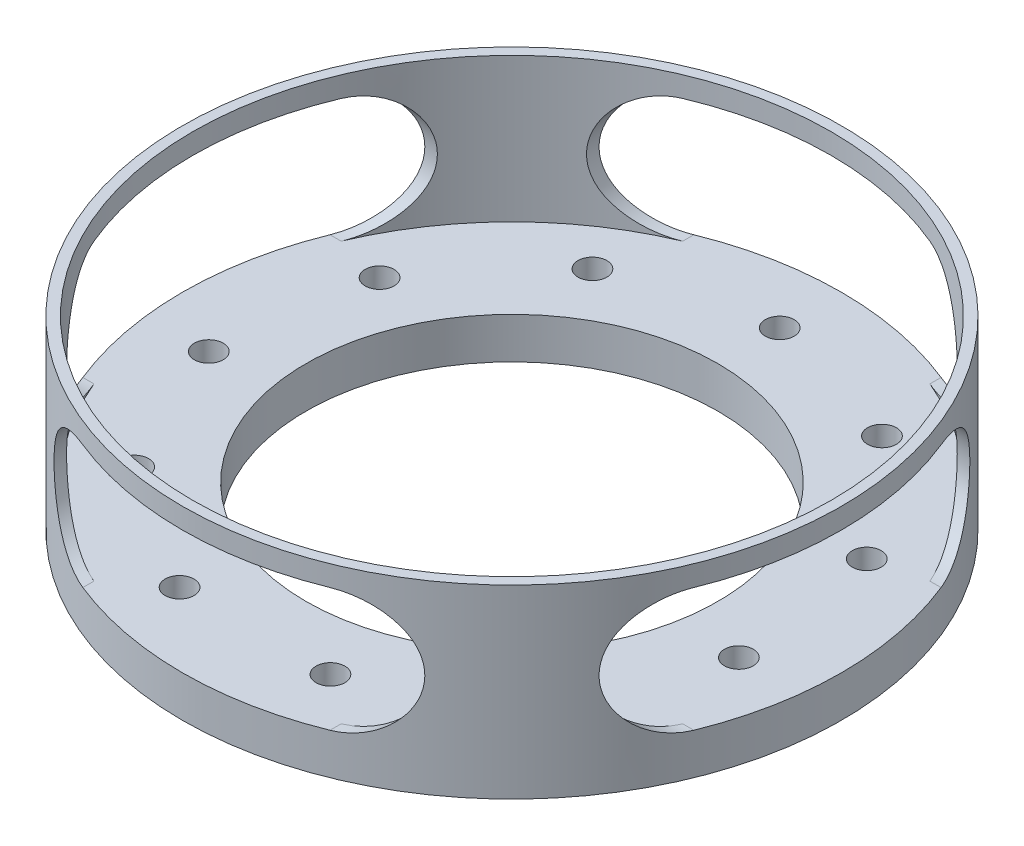
from build123d import *

# Parameters (mm, degrees)
BOSS_EXTRUDE1_OUTLINE_R  = 80
BOSS_EXTRUDE1_DEPTH      = 10
SKETCH2_R                = 3.5
CUT_EXTRUDE1_DEPTH       = 114.578166916
SKETCH4_R                = 7
CUT_EXTRUDE2_DEPTH       = 5
SKETCH5_R                = 80
SKETCH5_R_2              = 70
BOSS_EXTRUDE2_DEPTH      = 35
SKETCH6_R                = 12.5
CUT_EXTRUDE3_DEPTH       = 35
FILLET1_R                = 20
CIRPATTERN1_COUNT        = 11
FILLET1_OF_CIRPATTERN1_R = 20
SKETCH9_R                = 50
CUT_EXTRUDE5_DEPTH       = 10
SKETCH10_R               = 77.5
CUT_EXTRUDE6_DEPTH       = 35
CUT_EXTRUDE7_DEPTH       = 122.757956619
CIRPATTERN3_COUNT        = 4


# Read off the part's stored shape, not the designer's step: Boss-Extrude1
with BuildPart() as part:
    # Boss-Extrude1 outline → Boss-Extrude1 (new body)
    with BuildSketch(Plane(origin=(0, 0, 0), x_dir=(1, 0, 0), z_dir=(0, 1, 0))):
        Circle(BOSS_EXTRUDE1_OUTLINE_R)
    extrude(amount=BOSS_EXTRUDE1_DEPTH)

    # Sketch2 → Cut-Extrude1 (cut, symmetric)
    with BuildSketch(Plane(origin=(0, 10, 0), x_dir=(1, 0, 0), z_dir=(0, 1, 0))):
        with Locations(Location((0, 65, 0), (0, 0, 270))):
            Circle(SKETCH2_R)
    cut_extrude1 = extrude(amount=CUT_EXTRUDE1_DEPTH, both=True, mode=Mode.SUBTRACT)

    # Sketch4 → Cut-Extrude2 (cut)
    with BuildSketch(Plane.XZ):
        with Locations(Location((0, -65, 0), (0, 0, 270))):
            Circle(SKETCH4_R)
    cut_extrude2 = extrude(amount=-CUT_EXTRUDE2_DEPTH, mode=Mode.SUBTRACT)

    # Sketch5 → Boss-Extrude2 (add)
    with BuildSketch(Plane(origin=(0, 10, 0), x_dir=(1, 0, 0), z_dir=(0, 1, 0))):
        with Locations(Location((0, 0, 0), (0, 0, 270))):
            Circle(SKETCH5_R)
        with Locations(Location((0, 0, 0), (0, 0, 270))):
            Circle(SKETCH5_R_2, mode=Mode.SUBTRACT)
    extrude(amount=BOSS_EXTRUDE2_DEPTH)

    # Sketch6 → Cut-Extrude3 (cut)
    with BuildSketch(Plane(origin=(0, 45, 0), x_dir=(1, 0, 0), z_dir=(0, 1, 0))):
        with Locations((0, 65)):
            Circle(SKETCH6_R)
    cut_extrude3 = extrude(amount=-CUT_EXTRUDE3_DEPTH, mode=Mode.SUBTRACT)

    # Fillet1
    fillet1_edges = [part.edges().sort_by_distance(p)[0] for p in [
        (-11.84596263, 27.5, -68.990384615),
        (11.84596263, 27.5, -68.990384615),
    ]]
    fillet(fillet1_edges, radius=FILLET1_R)

    # CirPattern1: Cut-Extrude1, Cut-Extrude2, Cut-Extrude3 ×11 about axis
    cirpattern1_axis = Axis((0, 0, 0), (0, 1, 0))
    add([cut_extrude1.rotate(cirpattern1_axis, i * 360 / CIRPATTERN1_COUNT) for i in range(1, CIRPATTERN1_COUNT)], mode=Mode.SUBTRACT)
    add([cut_extrude2.rotate(cirpattern1_axis, i * 360 / CIRPATTERN1_COUNT) for i in range(1, CIRPATTERN1_COUNT)], mode=Mode.SUBTRACT)
    add([cut_extrude3.rotate(cirpattern1_axis, i * 360 / CIRPATTERN1_COUNT) for i in range(1, CIRPATTERN1_COUNT)], mode=Mode.SUBTRACT)

    # Fillet1 of CirPattern1
    fillet1_of_cirpattern1_edges = [part.edges().sort_by_distance(p)[0] for p in [
        (-47.264475847, 27.5, -51.633993869),
        (-27.333560023, 27.5, -64.442815709),
        (-67.676851938, 27.5, -17.884174898),
        (-57.834870498, 27.5, -39.435108146),
        (-66.60230572, 27.5, 21.543743239),
        (-69.974018232, 27.5, -1.907032382),
        (-44.381998026, 27.5, 54.13167512),
        (-59.89690959, 27.5, 36.226512689),
        (-8.070719546, 27.5, 69.533182625),
        (-30.802955364, 27.5, 62.858395946),
        (30.802955364, 27.5, 62.858395946),
        (8.070719546, 27.5, 69.533182625),
        (59.89690959, 27.5, 36.226512689),
        (44.381998026, 27.5, 54.13167512),
        (69.974018232, 27.5, -1.907032382),
        (66.60230572, 27.5, 21.543743239),
        (57.834870498, 27.5, -39.435108146),
        (67.676851938, 27.5, -17.884174898),
        (27.333560023, 27.5, -64.442815709),
        (47.264475847, 27.5, -51.633993869),
    ]]
    fillet(fillet1_of_cirpattern1_edges, radius=FILLET1_OF_CIRPATTERN1_R)

    # Sketch9 → Cut-Extrude5 (cut)
    with BuildSketch(Plane.XZ):
        with Locations(Location((0, 0, 0), (0, 0, 270))):
            Circle(SKETCH9_R)
    extrude(amount=-CUT_EXTRUDE5_DEPTH, mode=Mode.SUBTRACT)

    # Sketch10 → Cut-Extrude6 (cut)
    with BuildSketch(Plane(origin=(0, 45, 0), x_dir=(1, 0, 0), z_dir=(0, 1, 0))):
        with Locations(Location((0, 0, 0), (0, 0, 270))):
            Circle(SKETCH10_R)
    extrude(amount=-CUT_EXTRUDE6_DEPTH, mode=Mode.SUBTRACT)

    # Sketch12 → Cut-Extrude7 (cut, symmetric)
    with BuildSketch(Plane.XY):
        with BuildLine():
            Line((30, 10), (-30, 10))
            ThreePointArc((-30, 10), (-45, 25), (-30, 40))
            Line((-30, 40), (30, 40))
            ThreePointArc((30, 40), (45, 25), (30, 10))
        make_face()
    cut_extrude7 = extrude(amount=CUT_EXTRUDE7_DEPTH, both=True, mode=Mode.SUBTRACT)

    # CirPattern3: Cut-Extrude7 ×4 about axis
    cirpattern3_axis = Axis((0, 0, 0), (0, 1, 0))
    for i in range(1, CIRPATTERN3_COUNT):
        add(cut_extrude7.rotate(cirpattern3_axis, i * 360 / CIRPATTERN3_COUNT), mode=Mode.SUBTRACT)


solid = part.part
